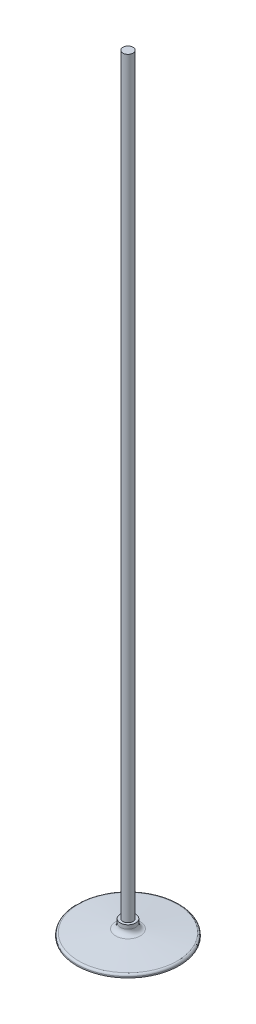
from build123d import *

# Parameters (mm, degrees)
FILLET1_R = 4
FILLET2_R = 10


with BuildPart() as part:
    # Sketch1 → Revolve1 (revolve)
    with BuildSketch(Plane.XY):
        Polygon((0, 0), (-100, 0), (-100, 6), (-15, 13.4365364), (-15, 30), (-10, 30), (-10, 1500), (0, 1500), align=None)
    revolve(axis=Axis((0, 0, 0), (0, -1, 0)))

    # Fillet1
    fillet1_edges = [part.edges().sort_by_distance(p)[0] for p in [
        (100, 6, 0),
    ]]
    fillet(fillet1_edges, radius=FILLET1_R)

    # Fillet2
    fillet2_edges = [part.edges().sort_by_distance(p)[0] for p in [
        (15, 13.4365364, 0),
    ]]
    fillet(fillet2_edges, radius=FILLET2_R)


solid = part.part
